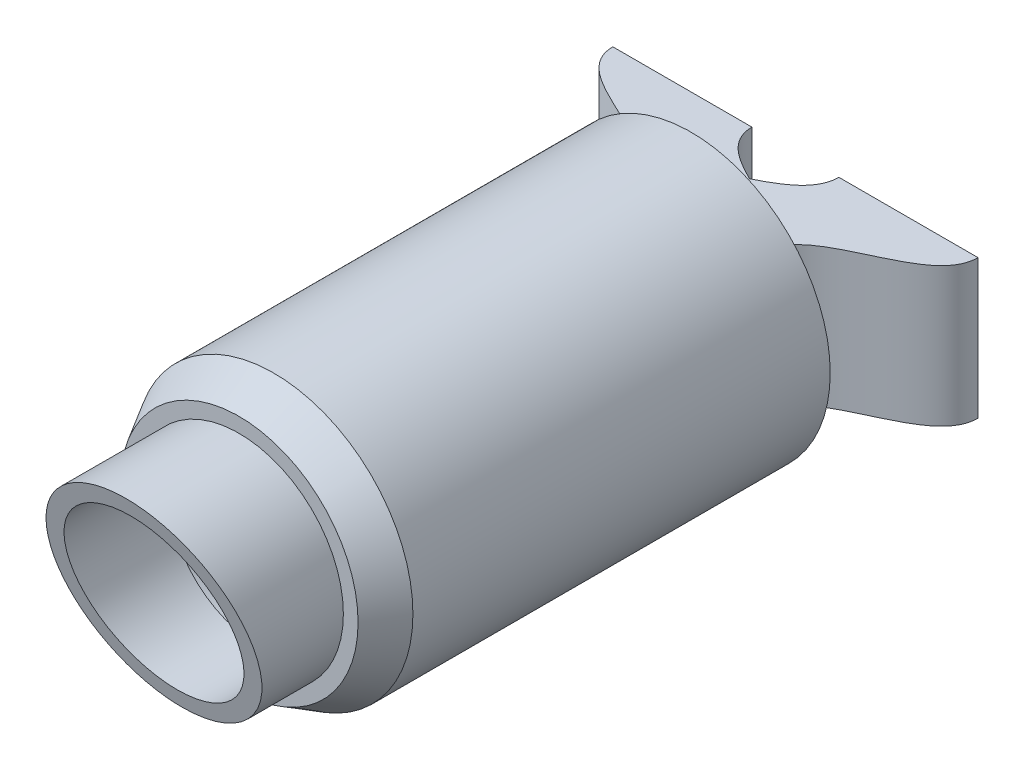
from build123d import *

# Parameters (mm, degrees)
LOFT1_START                    = -20
LOFT1_DEPTH                    = 40
SKETCH4_R                      = 40
BOSS_EXTRUDE1_DEPTH            = 130
SKETCH6_R                      = 30
BOSS_EXTRUDE2_DEPTH            = 32.5
CUT_EXTRUDE1_REACH             = 205.501
CUT_EXTRUDE1_DIRECTION_2_REACH = 205.501
SHELL1_START                   = -15
SHELL1_DEPTH                   = 30
SHELL1_START_2                 = 35
SHELL1_2_OUTLINE_R             = 35
SHELL1_2_DEPTH                 = 120
SHELL1_START_3                 = 155
SHELL1_3_OUTLINE_R             = 25
SHELL1_3_DEPTH                 = 36.160254138
CHAMFER1_SIZE                  = 10
CHAMFER1_SIZE2                 = 5.773502692


with BuildPart() as part:
    # Loft1: read off the stored shape, not the designer's step
    # Loft1 outline → Loft1 (new body)
    with BuildSketch(Plane(origin=(0, 0, 0), x_dir=(1, 0, 0), z_dir=(0, 1, 0)).offset(LOFT1_START)):
        with BuildLine():
            add(Edge.make_bspline(
                [(12.5, 0), (12.5, -14.743171677), (-20, -15.256828323), (-20, -30)],
                knots=[0, 0, 0, 0, 1, 1, 1, 1], degree=3))
            Line((-20, -30), (20, -30))
            add(Edge.make_bspline(
                [(52.5, 0), (52.5, -14.743171677), (20, -15.256828323), (20, -30)],
                knots=[0, 0, 0, 0, 1, 1, 1, 1], degree=3))
            Line((52.5, 0), (12.5, 0))
        make_face()
    loft1 = extrude(amount=LOFT1_DEPTH)

    # Mirror1: Loft1 across plane
    add(loft1.mirror(Plane(origin=(0, 0, 0), x_dir=(0, 0, 1), z_dir=(1, 0, 0))))

    # Sketch4 → Boss-Extrude1 (add)
    with BuildSketch(Plane.XY.offset(30)):
        Circle(SKETCH4_R)
    extrude(amount=BOSS_EXTRUDE1_DEPTH)

    # Sketch6 → Boss-Extrude2 (add)
    with BuildSketch(Plane.XY.offset(160)):
        Circle(SKETCH6_R)
    extrude(amount=BOSS_EXTRUDE2_DEPTH)

    # Sketch7 → Cut-Extrude1 (cut, up to next)
    with BuildSketch(Plane(origin=(0, 0, 0), x_dir=(0, 0, -1), z_dir=(1, 0, 0)), mode=Mode.PRIVATE) as cut_extrude1_sk1:
        Polygon((-192.5, 30), (-176.423048454, -30), (-192.5, -30), align=None)
    cut_extrude1_tool1 = extrude(cut_extrude1_sk1.sketch, amount=-CUT_EXTRUDE1_REACH, mode=Mode.PRIVATE) & part.part
    add(cut_extrude1_tool1.solids().sort_by_distance((0, -10, 187.141016))[0], mode=Mode.SUBTRACT)

    # Sketch7 → Cut-Extrude1 direction 2 (cut, up to next)
    with BuildSketch(Plane(origin=(0, 0, 0), x_dir=(0, 0, -1), z_dir=(1, 0, 0)), mode=Mode.PRIVATE) as cut_extrude1_direction_2_sk1:
        Polygon((-192.5, 30), (-176.423048454, -30), (-192.5, -30), align=None)
    cut_extrude1_direction_2_tool1 = extrude(cut_extrude1_direction_2_sk1.sketch, amount=CUT_EXTRUDE1_DIRECTION_2_REACH, mode=Mode.PRIVATE) & part.part
    add(cut_extrude1_direction_2_tool1.solids().sort_by_distance((0, -10, 187.141016))[0], mode=Mode.SUBTRACT)

    # Shell1: read off the stored shape, not the designer's step
    # Shell1 outline → Shell1 (cut)
    with BuildSketch(Plane(origin=(0, 0, 0), x_dir=(1, 0, 0), z_dir=(0, 1, 0)).offset(SHELL1_START)):
        with BuildLine():
            Line((47.5, 0), (17.5, 0))
            add(Edge.make_bspline(
                [(17.5, 0), (17.5, -1.506218599), (17.33399955, -2.987250563), (16.999427254, -4.425053416), (16.502786453, -5.794864031), (15.86070294, -7.067173852), (15.117084518, -8.228308405), (14.292439609, -9.294510623), (13.405573577, -10.271400977), (12.46835352, -11.173359287), (11.489787177, -12.010338652), (9.598195193, -13.470392121), (8.693632894, -14.107095997), (7.767923148, -14.708472127), (6.824629731, -15.280001305), (5.866921755, -15.826315732), (4.897910228, -16.351318437), (3.920788165, -16.858356925), (2.938878469, -17.350369773), (1.955654351, -17.829970666), (0.974757523, -18.299480071), (-3.2e-08, -18.760960517)],
                knots=[0, 0, 0, 0, 0, 0, 0, 0, 0, 0, 0, 0, 0.25, 0.25, 0.25, 0.25, 0.25, 0.25, 0.25, 0.25, 0.25, 0.25, 0.466915731, 0.466915731, 0.466915731, 0.466915731, 0.466915731, 0.466915731, 0.466915731, 0.466915731, 0.466915731, 0.466915731, 0.466915731, 0.466915731], degree=11))
            add(Edge.make_bspline(
                [(-17.5, 0), (-17.5, -1.506218599), (-17.33399955, -2.987250563), (-16.999427254, -4.425053416), (-16.502786453, -5.794864031), (-15.86070294, -7.067173852), (-15.117084518, -8.228308405), (-14.292439609, -9.294510623), (-13.405573577, -10.271400977), (-12.46835352, -11.173359287), (-11.489787177, -12.010338652), (-9.598195193, -13.470392121), (-8.693632894, -14.107095997), (-7.767923148, -14.708472127), (-6.824629731, -15.280001305), (-5.866921755, -15.826315732), (-4.897910228, -16.351318437), (-3.920788165, -16.858356925), (-2.938878469, -17.350369773), (-1.955654351, -17.829970666), (-0.974757523, -18.299480071), (-3.2e-08, -18.760960517)],
                knots=[0, 0, 0, 0, 0, 0, 0, 0, 0, 0, 0, 0, 0.25, 0.25, 0.25, 0.25, 0.25, 0.25, 0.25, 0.25, 0.25, 0.25, 0.466915731, 0.466915731, 0.466915731, 0.466915731, 0.466915731, 0.466915731, 0.466915731, 0.466915731, 0.466915731, 0.466915731, 0.466915731, 0.466915731], degree=11))
            Line((-17.5, 0), (-47.5, 0))
            add(Edge.make_bspline(
                [(-47.5, 0), (-47.5, -0.514445811), (-47.442606113, -0.954748074), (-47.343235937, -1.344982547), (-47.20786239, -1.71701478), (-47.032683037, -2.104520216), (-46.785831434, -2.534020993), (-46.453659069, -2.987849319), (-46.033568195, -3.468929964), (-45.523610975, -3.965111356), (-44.92878441, -4.472501548), (-44.254350078, -4.986036242), (-42.759882494, -6.019550229), (-41.939836626, -6.539523585), (-41.053705611, -7.059646016), (-40.109203396, -7.578354727), (-39.114184768, -8.095344655), (-38.076290995, -8.611274332), (-37.00285783, -9.127500697), (-35.900922044, -9.645890603), (-34.777228254, -10.168728121), (-33.638203396, -10.6987081), (-32.489931842, -11.238977858), (-30.186527619, -12.347342557), (-29.031403167, -12.915438814), (-27.878600203, -13.50109522), (-26.733767089, -14.108447325), (-25.601993275, -14.74224284), (-24.488271301, -15.408015923), (-23.397609723, -16.112248675), (-22.334958302, -16.862692425), (-21.305727237, -17.668903465), (-20.317487291, -18.542575049), (-19.382427303, -19.496419968), (-18.086266169, -21.060553347), (-17.671945246, -21.604157282), (-17.277574917, -22.171105072), (-16.905686161, -22.762232574), (-16.559152405, -23.37805829), (-16.24115549, -24.018580299), (-15.955047489, -24.683071375), (-15.704108297, -25.369982815), (-15.491239722, -26.077012338), (-15.318677624, -26.801336223), (-15.187844426, -27.539950625), (-15.088462731, -28.383769544), (-15.078084253, -28.477706063), (-15.068371148, -28.571815805), (-15.059324693, -28.666093197), (-15.050946004, -28.760532731), (-15.043236034, -28.855128964), (-15.036195574, -28.949876518), (-15.029825253, -29.044770082), (-15.024125537, -29.139804407), (-15.01909673, -29.234974312), (-15.014738975, -29.33027468), (-15.010130568, -29.449556902), (-15.009250832, -29.473421184), (-15.008413038, -29.497293228), (-15.007617184, -29.521172958), (-15.006863268, -29.545060297), (-15.006151287, -29.568955169), (-15.005481238, -29.592857497), (-15.00485312, -29.616767206), (-15.00426693, -29.640684218), (-15.003722666, -29.664608458), (-15.003220324, -29.688539849), (-15.002529692, -29.724447548), (-15.002309961, -29.73641855), (-15.002100708, -29.748391312), (-15.001901934, -29.760365825), (-15.001713636, -29.77234208), (-15.001535815, -29.784320068), (-15.001368469, -29.796299778), (-15.001211598, -29.808281203), (-15.001065201, -29.820264332), (-15.000929278, -29.832249158), (-15.000803827, -29.84423567), (-15.000631358, -29.862217953), (-15.000576486, -29.868212467), (-15.000524232, -29.8742074), (-15.000474596, -29.880202749), (-15.000427577, -29.886198514), (-15.000383175, -29.892194695), (-15.000341391, -29.898191288), (-15.000302224, -29.904188295), (-15.000265674, -29.910185713), (-15.000231741, -29.916183542), (-15.000200425, -29.922181779), (-15.000157376, -29.931179748), (-15.00014368, -29.934179173), (-15.000130639, -29.9371787), (-15.000118252, -29.940178328), (-15.000106518, -29.943178059), (-15.000095439, -29.94617789), (-15.000085014, -29.949177823), (-15.000075243, -29.952177857), (-15.000066126, -29.955177993), (-15.000057663, -29.958178229), (-15.000049855, -29.961178566), (-15.000039122, -29.965679222), (-15.000035708, -29.967179466), (-15.000032458, -29.968679735), (-15.000029371, -29.970180029), (-15.000026448, -29.971680349), (-15.000023688, -29.973180693), (-15.000021091, -29.974681063), (-15.000018658, -29.976181457), (-15.000016389, -29.977681877), (-15.000014283, -29.979182321), (-15.00001234, -29.980682791), (-15.000009671, -29.982933533), (-15.000008823, -29.983683786), (-15.000008015, -29.984434046), (-15.000007248, -29.985184312), (-15.000006522, -29.985934584), (-15.000005837, -29.986684863), (-15.000005192, -29.987435148), (-15.000004589, -29.988185439), (-15.000004026, -29.988935736), (-15.000003505, -29.989686039), (-15.000003024, -29.990436349), (-15.000002364, -29.991561823), (-15.000002154, -29.991936982), (-15.000001955, -29.992312143), (-15.000001765, -29.992687306), (-15.000001586, -29.99306247), (-15.000001417, -29.993437636), (-15.000001259, -29.993812803), (-15.00000111, -29.994187972), (-15.000000972, -29.994563142), (-15.000000844, -29.994938314), (-15.000000726, -29.995313488), (-15.000000564, -29.99587625), (-15.000000513, -29.996063838), (-15.000000465, -29.996251427), (-15.000000418, -29.996439015), (-15.000000375, -29.996626604), (-15.000000334, -29.996814194), (-15.000000295, -29.997001784), (-15.000000259, -29.997189374), (-15.000000226, -29.997376965), (-15.000000195, -29.997564556), (-15.000000167, -29.997752147), (-15.000000128, -29.998033535), (-15.000000116, -29.998127331), (-15.000000105, -29.998221127), (-15.000000094, -29.998314923), (-15.000000083, -29.998408719), (-15.000000074, -29.998502516), (-15.000000065, -29.998596312), (-15.000000056, -29.998690109), (-15.000000048, -29.998783905), (-15.000000041, -29.998877702), (-15.000000035, -29.998971499), (-15.000000029, -29.999065296), (-15.000000026, -29.999112194), (-15.000000023, -29.999159093), (-15.000000021, -29.999205991), (-15.000000018, -29.99925289), (-15.000000016, -29.999299788), (-15.000000014, -29.999346687), (-15.000000012, -29.999393586), (-15.00000001, -29.999440485), (-15.000000009, -29.999487383), (-15.000000007, -29.999534282), (-15.000000006, -29.999581181), (-15.000000004, -29.999651529), (-15.000000003, -29.999674978), (-15.000000003, -29.999698428), (-15.000000003, -29.999721877), (-15.000000002, -29.999745326), (-15.000000002, -29.999768776), (-15.000000001, -29.999792225), (-15.000000001, -29.999815675), (-15.000000001, -29.999839124), (-15.000000001, -29.999862573), (-15, -29.999886023), (-15, -29.999921197), (-15, -29.9999347), (-15, -29.99993727), (-15, -29.999967886), (-15, -29.999965469), (-15, -29.999965889), (-15, -30.000001924), (-15, -30.000018607), (-15, -29.99999597), (-15, -30.000021533), (-15, -30.000025657), (-15, -30.000041306), (-15, -30.000049131), (-15, -30.000056956), (-15, -30.000064781), (-15, -30.000072606), (-15, -30.000080431), (-15, -30.000088255), (-15, -30.00009608), (-15, -30.000103905), (-15, -30.00011173), (-15, -30.000119555), (-15, -30.00012738), (-15, -30.032177845), (-15, -30.064228311), (-15, -30.096278776), (-15, -30.128329242), (-15, -30.160379707), (-15, -30.192430173), (-15, -30.224480638), (-15, -30.256531104), (-15, -30.288581569), (-15, -30.320632035), (-15, -30.3526825), (-15, -30.512934828), (-15, -30.64113669), (-15, -30.769338552), (-15, -30.897540414), (-15, -31.025742276), (-15, -31.153944138), (-15, -31.282146), (-15, -31.410347862), (-15, -31.538549724), (-15, -31.666751586), (-15, -31.794953448), (-15, -32.179559035), (-15, -32.435962759), (-15, -32.692366483), (-15, -32.948770207), (-15, -33.205173931), (-15, -33.461577655), (-15, -33.717981379), (-15, -33.974385103), (-15, -34.230788828), (-15, -34.487192552), (-15, -34.743596276), (-15, -35)],
                knots=[0, 0, 0, 0, 0, 0, 0, 0, 0, 0, 0, 0, 0, 0.278261671, 0.278261671, 0.278261671, 0.278261671, 0.278261671, 0.278261671, 0.278261671, 0.278261671, 0.278261671, 0.278261671, 0.278261671, 0.556523342, 0.556523342, 0.556523342, 0.556523342, 0.556523342, 0.556523342, 0.556523342, 0.556523342, 0.556523342, 0.556523342, 0.556523342, 0.834785013, 0.834785013, 0.834785013, 0.834785013, 0.834785013, 0.834785013, 0.834785013, 0.834785013, 0.834785013, 0.834785013, 0.834785013, 0.973915848, 0.973915848, 0.973915848, 0.973915848, 0.973915848, 0.973915848, 0.973915848, 0.973915848, 0.973915848, 0.973915848, 0.973915848, 0.991307203, 0.991307203, 0.991307203, 0.991307203, 0.991307203, 0.991307203, 0.991307203, 0.991307203, 0.991307203, 0.991307203, 0.991307203, 0.995655041, 0.995655041, 0.995655041, 0.995655041, 0.995655041, 0.995655041, 0.995655041, 0.995655041, 0.995655041, 0.995655041, 0.995655041, 0.997828961, 0.997828961, 0.997828961, 0.997828961, 0.997828961, 0.997828961, 0.997828961, 0.997828961, 0.997828961, 0.997828961, 0.997828961, 0.99891592, 0.99891592, 0.99891592, 0.99891592, 0.99891592, 0.99891592, 0.99891592, 0.99891592, 0.99891592, 0.99891592, 0.99891592, 0.9994594, 0.9994594, 0.9994594, 0.9994594, 0.9994594, 0.9994594, 0.9994594, 0.9994594, 0.9994594, 0.9994594, 0.9994594, 0.99973114, 0.99973114, 0.99973114, 0.99973114, 0.99973114, 0.99973114, 0.99973114, 0.99973114, 0.99973114, 0.99973114, 0.99973114, 0.99986701, 0.99986701, 0.99986701, 0.99986701, 0.99986701, 0.99986701, 0.99986701, 0.99986701, 0.99986701, 0.99986701, 0.99986701, 0.999934945, 0.999934945, 0.999934945, 0.999934945, 0.999934945, 0.999934945, 0.999934945, 0.999934945, 0.999934945, 0.999934945, 0.999934945, 0.999968912, 0.999968912, 0.999968912, 0.999968912, 0.999968912, 0.999968912, 0.999968912, 0.999968912, 0.999968912, 0.999968912, 0.999968912, 0.999985896, 0.999985896, 0.999985896, 0.999985896, 0.999985896, 0.999985896, 0.999985896, 0.999985896, 0.999985896, 0.999985896, 0.999985896, 0.999985896, 0.999994388, 0.999994388, 0.999994388, 0.999994388, 0.999994388, 0.999994388, 0.999994388, 0.999994388, 0.999994388, 0.999994388, 0.999994388, 0.999998634, 0.999998634, 0.999998634, 0.999998634, 0.999998634, 0.999998634, 0.999998634, 0.999998634, 0.999998634, 0.999998634, 0.999998634, 1.000000757, 1.000000757, 1.000000757, 1.000000757, 1.000000757, 1.000000757, 1.000000757, 1.000000757, 1.000000757, 1.000000757, 1.000000757, 1.00000288, 1.00000288, 1.00000288, 1.00000288, 1.00000288, 1.00000288, 1.00000288, 1.00000288, 1.00000288, 1.00000288, 1.00000288, 1.00000288, 1.008698557, 1.008698557, 1.008698557, 1.008698557, 1.008698557, 1.008698557, 1.008698557, 1.008698557, 1.008698557, 1.008698557, 1.008698557, 1.043481266, 1.043481266, 1.043481266, 1.043481266, 1.043481266, 1.043481266, 1.043481266, 1.043481266, 1.043481266, 1.043481266, 1.043481266, 1.113046684, 1.113046684, 1.113046684, 1.113046684, 1.113046684, 1.113046684, 1.113046684, 1.113046684, 1.113046684, 1.113046684, 1.113046684, 1.113046684, 1.113046684], degree=12))
            Line((-15, -35), (15, -35))
            add(Edge.make_bspline(
                [(47.5, 0), (47.5, -0.514445811), (47.442606113, -0.954748074), (47.343235937, -1.344982547), (47.20786239, -1.71701478), (47.032683037, -2.104520216), (46.785831434, -2.534020993), (46.453659069, -2.987849319), (46.033568195, -3.468929964), (45.523610975, -3.965111356), (44.92878441, -4.472501548), (44.254350078, -4.986036242), (42.759882494, -6.019550229), (41.939836626, -6.539523585), (41.053705611, -7.059646016), (40.109203396, -7.578354727), (39.114184768, -8.095344655), (38.076290995, -8.611274332), (37.00285783, -9.127500697), (35.900922044, -9.645890603), (34.777228254, -10.168728121), (33.638203396, -10.6987081), (32.489931842, -11.238977858), (30.186527619, -12.347342557), (29.031403167, -12.915438814), (27.878600203, -13.50109522), (26.733767089, -14.108447325), (25.601993275, -14.74224284), (24.488271301, -15.408015923), (23.397609723, -16.112248675), (22.334958302, -16.862692425), (21.305727237, -17.668903465), (20.317487291, -18.542575049), (19.382427303, -19.496419968), (18.086266169, -21.060553347), (17.671945246, -21.604157282), (17.277574917, -22.171105072), (16.905686161, -22.762232574), (16.559152405, -23.37805829), (16.24115549, -24.018580299), (15.955047489, -24.683071375), (15.704108297, -25.369982815), (15.491239722, -26.077012338), (15.318677624, -26.801336223), (15.187844426, -27.539950625), (15.088462731, -28.383769544), (15.078084253, -28.477706063), (15.068371148, -28.571815805), (15.059324693, -28.666093197), (15.050946004, -28.760532731), (15.043236034, -28.855128964), (15.036195574, -28.949876518), (15.029825253, -29.044770082), (15.024125537, -29.139804407), (15.01909673, -29.234974312), (15.014738975, -29.33027468), (15.010130568, -29.449556902), (15.009250832, -29.473421184), (15.008413038, -29.497293228), (15.007617184, -29.521172958), (15.006863268, -29.545060297), (15.006151287, -29.568955169), (15.005481238, -29.592857497), (15.00485312, -29.616767206), (15.00426693, -29.640684218), (15.003722666, -29.664608458), (15.003220324, -29.688539849), (15.002529692, -29.724447548), (15.002309961, -29.73641855), (15.002100708, -29.748391312), (15.001901934, -29.760365825), (15.001713636, -29.77234208), (15.001535815, -29.784320068), (15.001368469, -29.796299778), (15.001211598, -29.808281203), (15.001065201, -29.820264332), (15.000929278, -29.832249158), (15.000803827, -29.84423567), (15.000631358, -29.862217953), (15.000576486, -29.868212467), (15.000524232, -29.8742074), (15.000474596, -29.880202749), (15.000427577, -29.886198514), (15.000383175, -29.892194695), (15.000341391, -29.898191288), (15.000302224, -29.904188295), (15.000265674, -29.910185713), (15.000231741, -29.916183542), (15.000200425, -29.922181779), (15.000157376, -29.931179748), (15.00014368, -29.934179173), (15.000130639, -29.9371787), (15.000118252, -29.940178328), (15.000106518, -29.943178059), (15.000095439, -29.94617789), (15.000085014, -29.949177823), (15.000075243, -29.952177857), (15.000066126, -29.955177993), (15.000057663, -29.958178229), (15.000049855, -29.961178566), (15.000039122, -29.965679222), (15.000035708, -29.967179466), (15.000032458, -29.968679735), (15.000029371, -29.970180029), (15.000026448, -29.971680349), (15.000023688, -29.973180693), (15.000021091, -29.974681063), (15.000018658, -29.976181457), (15.000016389, -29.977681877), (15.000014283, -29.979182321), (15.00001234, -29.980682791), (15.000009671, -29.982933533), (15.000008823, -29.983683786), (15.000008015, -29.984434046), (15.000007248, -29.985184312), (15.000006522, -29.985934584), (15.000005837, -29.986684863), (15.000005192, -29.987435148), (15.000004589, -29.988185439), (15.000004026, -29.988935736), (15.000003505, -29.989686039), (15.000003024, -29.990436349), (15.000002364, -29.991561823), (15.000002154, -29.991936982), (15.000001955, -29.992312143), (15.000001765, -29.992687306), (15.000001586, -29.99306247), (15.000001417, -29.993437636), (15.000001259, -29.993812803), (15.00000111, -29.994187972), (15.000000972, -29.994563142), (15.000000844, -29.994938314), (15.000000726, -29.995313488), (15.000000564, -29.99587625), (15.000000513, -29.996063838), (15.000000465, -29.996251427), (15.000000418, -29.996439015), (15.000000375, -29.996626604), (15.000000334, -29.996814194), (15.000000295, -29.997001784), (15.000000259, -29.997189374), (15.000000226, -29.997376965), (15.000000195, -29.997564556), (15.000000167, -29.997752147), (15.000000128, -29.998033535), (15.000000116, -29.998127331), (15.000000105, -29.998221127), (15.000000094, -29.998314923), (15.000000083, -29.998408719), (15.000000074, -29.998502516), (15.000000065, -29.998596312), (15.000000056, -29.998690109), (15.000000048, -29.998783905), (15.000000041, -29.998877702), (15.000000035, -29.998971499), (15.000000029, -29.999065296), (15.000000026, -29.999112194), (15.000000023, -29.999159093), (15.000000021, -29.999205991), (15.000000018, -29.99925289), (15.000000016, -29.999299788), (15.000000014, -29.999346687), (15.000000012, -29.999393586), (15.00000001, -29.999440485), (15.000000009, -29.999487383), (15.000000007, -29.999534282), (15.000000006, -29.999581181), (15.000000004, -29.999651529), (15.000000003, -29.999674978), (15.000000003, -29.999698428), (15.000000003, -29.999721877), (15.000000002, -29.999745326), (15.000000002, -29.999768776), (15.000000001, -29.999792225), (15.000000001, -29.999815675), (15.000000001, -29.999839124), (15.000000001, -29.999862573), (15, -29.999886023), (15, -29.999921197), (15, -29.9999347), (15, -29.99993727), (15, -29.999967886), (15, -29.999965469), (15, -29.999965889), (15, -30.000001924), (15, -30.000018607), (15, -29.99999597), (15, -30.000021533), (15, -30.000025657), (15, -30.000041306), (15, -30.000049131), (15, -30.000056956), (15, -30.000064781), (15, -30.000072606), (15, -30.000080431), (15, -30.000088255), (15, -30.00009608), (15, -30.000103905), (15, -30.00011173), (15, -30.000119555), (15, -30.00012738), (15, -30.032177845), (15, -30.064228311), (15, -30.096278776), (15, -30.128329242), (15, -30.160379707), (15, -30.192430173), (15, -30.224480638), (15, -30.256531104), (15, -30.288581569), (15, -30.320632035), (15, -30.3526825), (15, -30.512934828), (15, -30.64113669), (15, -30.769338552), (15, -30.897540414), (15, -31.025742276), (15, -31.153944138), (15, -31.282146), (15, -31.410347862), (15, -31.538549724), (15, -31.666751586), (15, -31.794953448), (15, -32.179559035), (15, -32.435962759), (15, -32.692366483), (15, -32.948770207), (15, -33.205173931), (15, -33.461577655), (15, -33.717981379), (15, -33.974385103), (15, -34.230788828), (15, -34.487192552), (15, -34.743596276), (15, -35)],
                knots=[0, 0, 0, 0, 0, 0, 0, 0, 0, 0, 0, 0, 0, 0.278261671, 0.278261671, 0.278261671, 0.278261671, 0.278261671, 0.278261671, 0.278261671, 0.278261671, 0.278261671, 0.278261671, 0.278261671, 0.556523342, 0.556523342, 0.556523342, 0.556523342, 0.556523342, 0.556523342, 0.556523342, 0.556523342, 0.556523342, 0.556523342, 0.556523342, 0.834785013, 0.834785013, 0.834785013, 0.834785013, 0.834785013, 0.834785013, 0.834785013, 0.834785013, 0.834785013, 0.834785013, 0.834785013, 0.973915848, 0.973915848, 0.973915848, 0.973915848, 0.973915848, 0.973915848, 0.973915848, 0.973915848, 0.973915848, 0.973915848, 0.973915848, 0.991307203, 0.991307203, 0.991307203, 0.991307203, 0.991307203, 0.991307203, 0.991307203, 0.991307203, 0.991307203, 0.991307203, 0.991307203, 0.995655041, 0.995655041, 0.995655041, 0.995655041, 0.995655041, 0.995655041, 0.995655041, 0.995655041, 0.995655041, 0.995655041, 0.995655041, 0.997828961, 0.997828961, 0.997828961, 0.997828961, 0.997828961, 0.997828961, 0.997828961, 0.997828961, 0.997828961, 0.997828961, 0.997828961, 0.99891592, 0.99891592, 0.99891592, 0.99891592, 0.99891592, 0.99891592, 0.99891592, 0.99891592, 0.99891592, 0.99891592, 0.99891592, 0.9994594, 0.9994594, 0.9994594, 0.9994594, 0.9994594, 0.9994594, 0.9994594, 0.9994594, 0.9994594, 0.9994594, 0.9994594, 0.99973114, 0.99973114, 0.99973114, 0.99973114, 0.99973114, 0.99973114, 0.99973114, 0.99973114, 0.99973114, 0.99973114, 0.99973114, 0.99986701, 0.99986701, 0.99986701, 0.99986701, 0.99986701, 0.99986701, 0.99986701, 0.99986701, 0.99986701, 0.99986701, 0.99986701, 0.999934945, 0.999934945, 0.999934945, 0.999934945, 0.999934945, 0.999934945, 0.999934945, 0.999934945, 0.999934945, 0.999934945, 0.999934945, 0.999968912, 0.999968912, 0.999968912, 0.999968912, 0.999968912, 0.999968912, 0.999968912, 0.999968912, 0.999968912, 0.999968912, 0.999968912, 0.999985896, 0.999985896, 0.999985896, 0.999985896, 0.999985896, 0.999985896, 0.999985896, 0.999985896, 0.999985896, 0.999985896, 0.999985896, 0.999985896, 0.999994388, 0.999994388, 0.999994388, 0.999994388, 0.999994388, 0.999994388, 0.999994388, 0.999994388, 0.999994388, 0.999994388, 0.999994388, 0.999998634, 0.999998634, 0.999998634, 0.999998634, 0.999998634, 0.999998634, 0.999998634, 0.999998634, 0.999998634, 0.999998634, 0.999998634, 1.000000757, 1.000000757, 1.000000757, 1.000000757, 1.000000757, 1.000000757, 1.000000757, 1.000000757, 1.000000757, 1.000000757, 1.000000757, 1.00000288, 1.00000288, 1.00000288, 1.00000288, 1.00000288, 1.00000288, 1.00000288, 1.00000288, 1.00000288, 1.00000288, 1.00000288, 1.00000288, 1.008698557, 1.008698557, 1.008698557, 1.008698557, 1.008698557, 1.008698557, 1.008698557, 1.008698557, 1.008698557, 1.008698557, 1.008698557, 1.043481266, 1.043481266, 1.043481266, 1.043481266, 1.043481266, 1.043481266, 1.043481266, 1.043481266, 1.043481266, 1.043481266, 1.043481266, 1.113046684, 1.113046684, 1.113046684, 1.113046684, 1.113046684, 1.113046684, 1.113046684, 1.113046684, 1.113046684, 1.113046684, 1.113046684, 1.113046684, 1.113046684], degree=12))
        make_face()
    extrude(amount=SHELL1_DEPTH, mode=Mode.SUBTRACT)

    # Shell1 2 outline → Shell1 2 (cut)
    with BuildSketch(Plane.XY.offset(SHELL1_START_2)):
        Circle(SHELL1_2_OUTLINE_R)
    extrude(amount=SHELL1_2_DEPTH, mode=Mode.SUBTRACT)

    # Shell1 3 outline → Shell1 3 (cut)
    with BuildSketch(Plane.XY.offset(SHELL1_START_3)):
        Circle(SHELL1_3_OUTLINE_R)
    extrude(amount=SHELL1_3_DEPTH, mode=Mode.SUBTRACT)

    # Chamfer1
    chamfer1_edges = [part.edges().sort_by_distance(p)[0] for p in [
        (-40, 0, 160),
    ]]
    chamfer1_side = [part.faces().sort_by_distance(p)[0] for p in [
        (-40, 0, 95),
    ]]
    chamfer(chamfer1_edges, length=CHAMFER1_SIZE, length2=CHAMFER1_SIZE2, reference=chamfer1_side[0])


solid = part.part
